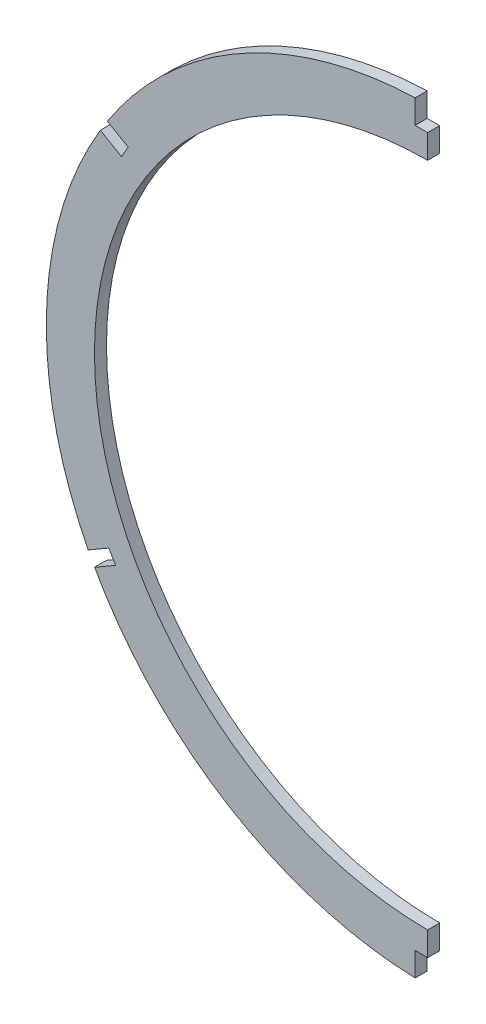
from build123d import *

# Parameters (mm, degrees)
BOSS_EXTRUDE1_DEPTH = 3.175
SKETCH3_W           = 149.303507008
SKETCH3_H           = 288.678903575
CUT_EXTRUDE1_DEPTH  = 147.667755045
SKETCH4_W           = 3.302
SKETCH4_H           = 7.449124121
SKETCH4_H_2         = 9.965839279
CUT_EXTRUDE2_DEPTH  = 147.667755045


with BuildPart() as part:
    # Sketch2 → Boss-Extrude1 (new body)
    with BuildSketch(Plane.XY):
        with BuildLine():
            ThreePointArc((-1.783927604, 106.664181958), (-86.289926541, 57.796410124), (-89.548347912, -39.767444199))
            ThreePointArc((-89.548347912, -39.767444199), (-89.139366423, -40.557656379), (-88.723411943, -41.344220438))
            ThreePointArc((-88.723411943, -41.344220438), (-88.300763494, -42.126623343), (-87.87121564, -42.905259753))
            ThreePointArc((-87.87121564, -42.905259753), (0, -94.523651503), (87.87121564, -42.905259753))
            ThreePointArc((87.87121564, -42.905259753), (88.300763494, -42.126623343), (88.723411943, -41.344220438))
            ThreePointArc((88.723411943, -41.344220438), (89.139366423, -40.557656379), (89.548347912, -39.767444199))
            ThreePointArc((89.548347912, -39.767444199), (86.289926541, 57.796410124), (1.783927604, 106.664181958))
            ThreePointArc((1.783927604, 106.664181958), (0.891998866, 106.676045412), (0, 106.68))
            ThreePointArc((0, 106.68), (-0.891998866, 106.676045412), (-1.783927604, 106.664181958))
        make_face()
        with BuildLine():
            ThreePointArc((-7.652045127, 93.646303016), (0, -81.823651503), (7.652045127, 93.646303016))
            ThreePointArc((7.652045127, 93.646303016), (4.717664566, 93.853310885), (1.778000524, 93.962016248))
            ThreePointArc((1.778000524, 93.962016248), (0.889045735, 93.975503947), (0, 93.98))
            ThreePointArc((0, 93.98), (-0.889045735, 93.975503947), (-1.778000524, 93.962016248))
            ThreePointArc((-1.778000524, 93.962016248), (-4.717664566, 93.853310885), (-7.652045127, 93.646303016))
        make_face(mode=Mode.SUBTRACT)
    extrude(amount=-BOSS_EXTRUDE1_DEPTH)

    # Sketch3 → Cut-Extrude1 (cut, through all)
    with BuildSketch(Plane(origin=(0, 0, 0), x_dir=(0, 0, -1), z_dir=(1, 0, 0))):
        with Locations((2.160275602, 8.369276658)):
            Rectangle(SKETCH3_W, SKETCH3_H)
    extrude(amount=CUT_EXTRUDE1_DEPTH, mode=Mode.SUBTRACT)

    # Sketch4 → Cut-Extrude2 (cut, through all)
    with BuildSketch(Plane.XY):
        Polygon((-88.109110822, 62.776111712), (-78.996562371, 57.51497941), (-80.761862371, 54.45739012), (-89.874410822, 59.718522421), align=None)
        Polygon((-84.09504483, -36.64600391), (-82.32974483, -39.7035932), (-90.457535691, -44.396175442), (-92.222835691, -41.338586151), align=None)
        with Locations((-1.651, -91.898213564)):
            Rectangle(SKETCH4_W, SKETCH4_H)
        with Locations((-1.651, 105.31291964)):
            Rectangle(SKETCH4_W, SKETCH4_H_2)
    extrude(amount=-CUT_EXTRUDE2_DEPTH, mode=Mode.SUBTRACT)


solid = part.part
